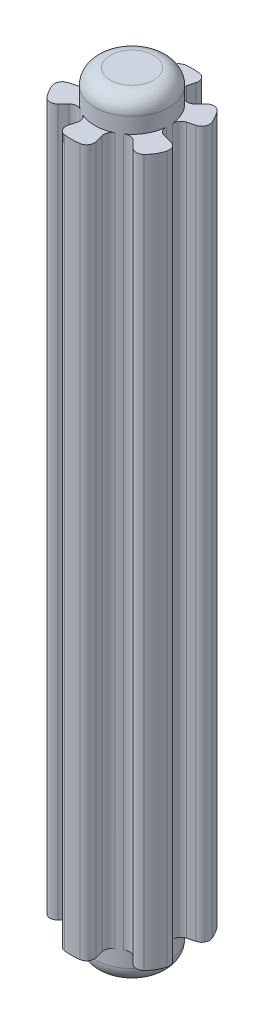
from build123d import *
from build123d.topology import SkipClean

# Parameters (mm, degrees)
BOSS_EXTRUDE1_DEPTH = 45
SKETCH4_R           = 2.375
BOSS_EXTRUDE3_DEPTH = 2
FILLET1_R           = 0.5
BOSS_EXTRUDE5_START = 2
SKETCH6_R           = 2.375
BOSS_EXTRUDE5_DEPTH = 2
FILLET2_R           = 1


with BuildPart() as part:
    # Sketch2 → Boss-Extrude1 (new body)
    with BuildSketch(Plane(origin=(0, 0, 0), x_dir=(1, 0, 0), z_dir=(0, 1, 0))):
        with BuildLine():
            Line((3.775215965, -0.978645895), (2.300774305, -0.58912019))
            ThreePointArc((2.300774305, -0.58912019), (2.374963211, 0.013219106), (2.294073837, 0.614695232))
            Line((2.294073837, 0.614695232), (3.742962577, 1.0029238))
            ThreePointArc((3.742962577, 1.0029238), (3.356294138, 1.936727823), (2.741299364, 2.73877761))
            Line((2.741299364, 2.73877761), (1.680151223, 1.678605632))
            ThreePointArc((1.680151223, 1.678605632), (1.187973207, 2.056537055), (0.614695232, 2.294073837))
            Line((0.614695232, 2.294073837), (1.0029238, 3.742962577))
            ThreePointArc((1.0029238, 3.742962577), (0, 3.875), (-1.0029238, 3.742962577))
            Line((-1.0029238, 3.742962577), (-0.614695232, 2.294073837))
            ThreePointArc((-0.614695232, 2.294073837), (-1.1875, 2.056810334), (-1.679378605, 1.679378605))
            Line((-1.679378605, 1.679378605), (-2.740038777, 2.740038777))
            ThreePointArc((-2.740038777, 2.740038777), (-3.35584844, 1.9375), (-3.742962577, 1.0029238))
            Line((-3.742962577, 1.0029238), (-2.294073837, 0.614695232))
            ThreePointArc((-2.294073837, 0.614695232), (-2.375, 0), (-2.294073837, -0.614695232))
            Line((-2.294073837, -0.614695232), (-3.742962577, -1.0029238))
            ThreePointArc((-3.742962577, -1.0029238), (-3.35584844, -1.9375), (-2.740038777, -2.740038777))
            Line((-2.740038777, -2.740038777), (-1.679378605, -1.679378605))
            ThreePointArc((-1.679378605, -1.679378605), (-1.1875, -2.056810334), (-0.614695232, -2.294073837))
            Line((-0.614695232, -2.294073837), (-1.0029238, -3.742962577))
            ThreePointArc((-1.0029238, -3.742962577), (0.033967076, -3.874851125), (1.068386506, -3.724805401))
            Line((1.068386506, -3.724805401), (0.681359786, -2.275164575))
            ThreePointArc((0.681359786, -2.275164575), (1.238849907, -2.026296106), (1.714477211, -1.643530618))
            Line((1.714477211, -1.643530618), (2.767163136, -2.698133353))
            ThreePointArc((2.767163136, -2.698133353), (3.500652231, -1.972912562), (3.775215965, -0.978645895))
        make_face()
        Polygon((0.085836926, -0.044584082), (0, 0), (0.073933818, 0), (0.104207494, -0.030328801), (0.080162685, -0.023330742), align=None, mode=Mode.SUBTRACT)
    extrude(amount=BOSS_EXTRUDE1_DEPTH)

    # Sketch4 → Boss-Extrude3 (add)
    with BuildSketch(Plane(origin=(0, 45, 0), x_dir=(1, 0, 0), z_dir=(0, 1, 0))):
        with Locations(Location((0, 0, 0), (0, 0, 75))):
            Circle(SKETCH4_R)
    extrude(amount=BOSS_EXTRUDE3_DEPTH)

    # Fillet1
    # the kernel refuses this fillet: 0.5 mm, written as the material it adds along each edge
    with BuildSketch(Plane(origin=(-2.294073837, 0, 0.614695232), x_dir=(-0.1735157400494046, 0, -0.9848310961556339), z_dir=(0, 1, 0)), Plane(origin=(-1.679378605, 0, -1.679378605), x_dir=(0.7661308776829403, 0, -0.6426845869170722), z_dir=(0, 1, 0)), Plane(origin=(0.614695232, 0, -2.294073837), x_dir=(0.939646617732385, 0, 0.3421465092384974), z_dir=(0, 1, 0)), Plane(origin=(2.294073837, 0, -0.614695232), x_dir=(0.1735157400495284, 0, 0.9848310961556122), z_dir=(0, 1, 0)), Plane(origin=(-0.614695232, 0, 2.294073837), x_dir=(-0.9396466177323688, 0, -0.3421465092385419), z_dir=(0, 1, 0))) as fillet1_piece_1:
        with BuildLine():
            CenterArc((0.458270974, 0.498091484), FILLET1_R, 185.007705084, 79.984589832)
            Line((-0.03982051, 0.45444663), (0, 0))
            ThreePointArc((0, 0), (0.20731306, 0.00906545), (0.414626119, 0))
        make_face()
    extrude(amount=45)
    with BuildSketch(Plane(origin=(-2.294073837, 0, -0.614695232), x_dir=(-0.17351574004940104, 0, 0.9848310961556345), z_dir=(0, 1, 0)), Plane(origin=(-0.614695232, 0, -2.294073837), x_dir=(-0.9396466177323672, 0, 0.3421465092385461), z_dir=(0, 1, 0)), Plane(origin=(1.680151223, 0, -1.678605632), x_dir=(-0.7658350540129166, 0, -0.643037067395833), z_dir=(0, 1, 0))) as fillet1_piece_2:
        with BuildLine():
            CenterArc((0.458270974, -0.498091484), FILLET1_R, 95.007705084, 79.984589832)
            Line((-0.03982051, -0.45444663), (0, 0))
            ThreePointArc((0, 0), (0.20731306, -0.00906545), (0.414626119, 0))
        make_face()
    extrude(amount=45)
    with BuildSketch(Plane(origin=(2.300774305, 0, 0.58912019), x_dir=(0.9668296370387235, 0, 0.2554221073900419), z_dir=(0, 1, 0))) as fillet1_piece_3:
        with BuildLine():
            CenterArc((0.453002414, 0.5), FILLET1_R, 190.38170854, 79.61829146)
            ThreePointArc((-0.038812111, 0.409897433), (-0.010506812, 0.205791362), (0, 0))
            Line((0, 0), (0.453002414, 0))
        make_face()
    extrude(amount=45)
    with BuildSketch(Plane(origin=(1.714477211, 0, 1.643530618), x_dir=(0.7064632978713469, 0, 0.7077496794494086), z_dir=(0, 1, 0))) as fillet1_piece_4:
        with BuildLine():
            CenterArc((0.465508471, -0.5), FILLET1_R, 90, 81.041880237)
            ThreePointArc((-0.02839274, -0.422143763), (-0.00477723, -0.211705398), (0, 0))
            Line((0, 0), (0.465508471, 0))
        make_face()
    extrude(amount=45)
    with BuildSketch(Plane(origin=(0.681359786, 0, 2.275164575), x_dir=(0.25794627414893684, 0, 0.966159262053975), z_dir=(0, 1, 0))) as fillet1_piece_5:
        with BuildLine():
            CenterArc((0.443713653, 0.5), FILLET1_R, 191.464392376, 78.535607624)
            ThreePointArc((-0.046310555, 0.400620549), (-0.014636445, 0.201295026), (0, 0))
            Line((0, 0), (0.443713653, 0))
        make_face()
    extrude(amount=45)
    with BuildSketch(Plane(origin=(-1.679378605, 0, 1.679378605), x_dir=(-0.7071067811865471, 0, 0.707106781186548), z_dir=(0, 1, 0))) as fillet1_piece_6:
        with BuildLine():
            CenterArc((0.456187913, 0.5), FILLET1_R, 190.015410168, 79.984589832)
            ThreePointArc((-0.036192593, 0.413043478), (-0.00906545, 0.20731306), (0, 0))
            Line((0, 0), (0.456187913, 0))
        make_face()
    extrude(amount=45)
    # the kernel refuses this fillet: 0.5 mm, written as the material it takes off along each edge
    with BuildSketch(Plane(origin=(-2.740038777, -1.439160897, 2.740038777), x_dir=(-0.6526300069150477, 0, -0.7576767609436524), z_dir=(0, 1, 0)), Plane(origin=(-3.742962577, -1.439160897, -1.0029238), x_dir=(0.3298523193767966, 0, -0.9440325457322686), z_dir=(0, 1, 0)), Plane(origin=(2.741299364, -1.439160897, -2.73877761), x_dir=(0.652281279601926, 0, 0.7579769998363237), z_dir=(0, 1, 0))) as fillet1_2_piece_1:
        with BuildLine():
            CenterArc((0.538524723, -0.49861874), FILLET1_R, 85.740187873, 98.519624254)
            Line((0.039905983, -0.535758376), (0, 0))
            ThreePointArc((0, 0), (0.287832179, 0.010704768), (0.575664359, 0))
        make_face()
    extrude(amount=47.878321794, mode=Mode.SUBTRACT)
    with BuildSketch(Plane(origin=(-3.742962577, -1.439160897, 1.0029238), x_dir=(0.9659258262890679, 0, -0.2588190451025218), z_dir=(0, 1, 0)), Plane(origin=(-2.740038777, -1.439160897, -2.740038777), x_dir=(0.7071067811865476, 0, 0.7071067811865476), z_dir=(0, 1, 0)), Plane(origin=(3.742962577, -1.439160897, -1.0029238), x_dir=(-0.9659258262890681, 0, 0.25881904510252185), z_dir=(0, 1, 0)), Plane(origin=(-1.0029238, -1.439160897, 3.742962577), x_dir=(0.2588190451025216, 0, -0.9659258262890681), z_dir=(0, 1, 0))) as fillet1_2_piece_2:
        with BuildLine():
            CenterArc((0.537242519, -0.5), FILLET1_R, 90, 98.519624254)
            ThreePointArc((0.04275993, -0.574074074), (0.010704768, -0.287832179), (0, 0))
            Line((0, 0), (0.537242519, 0))
        make_face()
    extrude(amount=47.878321794, mode=Mode.SUBTRACT)
    with BuildSketch(Plane(origin=(-1.0029238, -1.439160897, -3.742962577), x_dir=(0.25881904510252174, 0, 0.965925826289068), z_dir=(0, 1, 0))) as fillet1_2_piece_3:
        with BuildLine():
            CenterArc((0.537242519, 0.5), FILLET1_R, 171.480375746, 98.519624254)
            ThreePointArc((0.04275993, 0.574074074), (0.010704768, 0.287832179), (0, 0))
            Line((0, 0), (0.537242519, 0))
        make_face()
    extrude(amount=47.878321794, mode=Mode.SUBTRACT)
    with BuildSketch(Plane(origin=(1.0029238, -1.439160897, -3.742962577), x_dir=(-0.9824823262918377, 0, -0.1863557847886099), z_dir=(0, 1, 0))) as fillet1_2_piece_4:
        with BuildLine():
            CenterArc((0.538524723, 0.49861874), FILLET1_R, 175.740187873, 98.519624254)
            Line((0.039905983, 0.535758376), (0, 0))
            ThreePointArc((0, 0), (0.287832179, -0.010704768), (0.575664359, 0))
        make_face()
    extrude(amount=47.878321794, mode=Mode.SUBTRACT)
    with BuildSketch(Plane(origin=(3.775215965, -1.264396568, 0.978645895), x_dir=(-0.9668296370387236, 0, -0.25542210739004173), z_dir=(0, 1, 0))) as fillet1_2_piece_5:
        with BuildLine():
            CenterArc((0.437999819, 0.5), FILLET1_R, 179.77718135, 90.22281865)
            ThreePointArc((-0.0619964, 0.501944455), (-0.046928547, 0.249004631), (0, 0))
            Line((0, 0), (0.437999819, 0))
        make_face()
    extrude(amount=47.528793137, mode=Mode.SUBTRACT)
    with BuildSketch(Plane(origin=(2.767163136, -1.241563867, 2.698133353), x_dir=(0.8000663385432955, 0, -0.5999115384203949), z_dir=(0, 1, 0))) as fillet1_2_piece_6:
        with BuildLine():
            CenterArc((0.434547354, 0.496131331), FILLET1_R, 188.084320914, 89.047719887)
            Line((-0.060483736, 0.425816179), (0, 0))
            ThreePointArc((0, 0), (0.248312773, -0.015474675), (0.496625547, 0))
        make_face()
    extrude(amount=47.483127735, mode=Mode.SUBTRACT)
    with BuildSketch(Plane(origin=(1.068386506, -1.410819518, 3.724805401), x_dir=(-0.9787647804449897, 0, 0.20498659605074468), z_dir=(0, 1, 0))) as fillet1_2_piece_7:
        with BuildLine():
            CenterArc((0.527919562, -0.498672678), FILLET1_R, 85.824226653, 97.295295094)
            Line((0.028660468, -0.525882193), (0, 0))
            ThreePointArc((0, 0), (0.282163904, 0.010286747), (0.564327807, 0))
        make_face()
    extrude(amount=47.821639036, mode=Mode.SUBTRACT)

    # Sketch6 → Boss-Extrude5 (add)
    with SkipClean():  # the faces are left unmerged after this step: merging them gives an invalid solid
        with BuildSketch(Plane.XZ.offset(BOSS_EXTRUDE5_START)):
            with Locations(Location((0, 0, 0), (0, 0, 270))):
                Circle(SKETCH6_R)
        extrude(amount=-BOSS_EXTRUDE5_DEPTH)

    # Fillet2
    fillet2_edges = [part.edges().sort_by_distance(p)[0] for p in [
        (-0.614695232, 47, 2.294073837),
        (0, -2, 2.375),
    ]]
    fillet(fillet2_edges, radius=FILLET2_R)


solid = part.part
